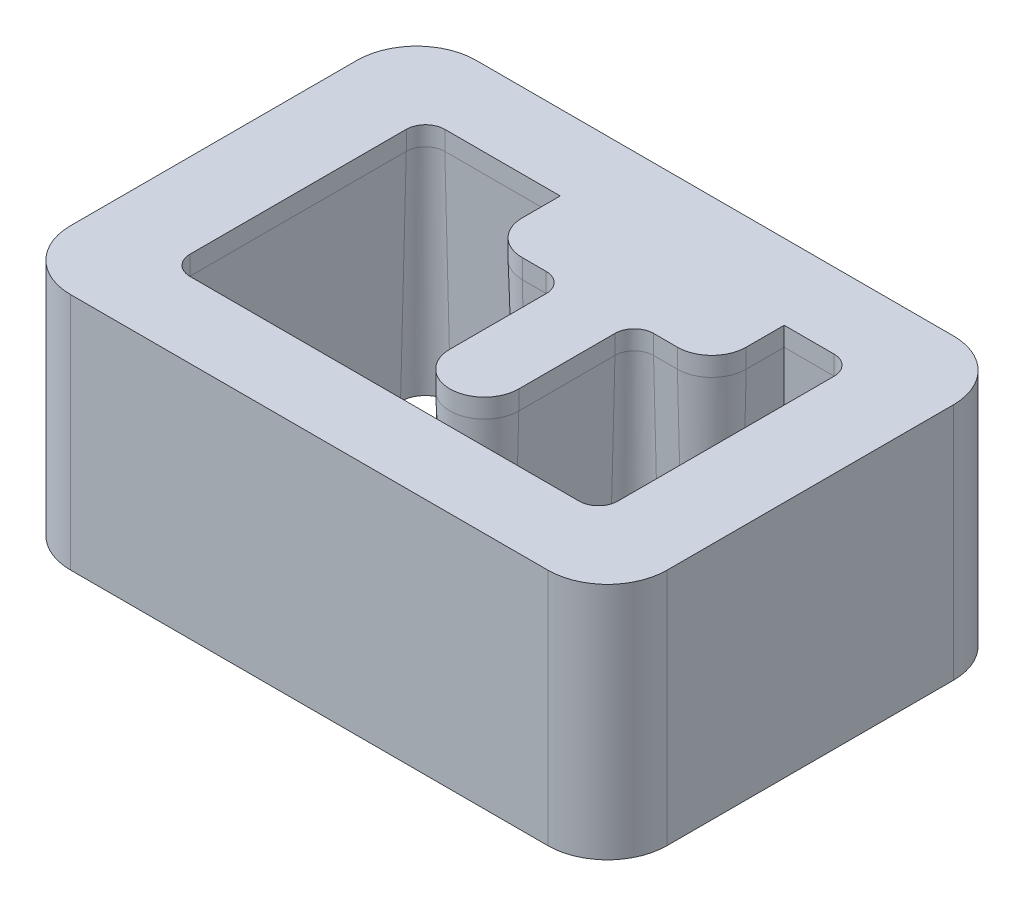
from build123d import *

# Parameters (mm, degrees)
SKETCH1_W                   = 100
SKETCH1_H                   = 68
BOSS_EXTRUDE1_DEPTH         = 40
FILLET1_R                   = 10
CUT_EXTRUDE1_REACH          = 74.498
M6_TAPPED_HOLE1_D           = 5
M6_TAPPED_HOLE1_DEPTH       = 17
M6_TAPPED_HOLE1_CSINK_D     = 6.05
M6_TAPPED_HOLE1_CSINK_ANGLE = 90
M6_TAPPED_HOLE1_TIP         = 1.502151548


with BuildPart() as part:
    # Sketch1 → Boss-Extrude1 (new body)
    with BuildSketch(Plane(origin=(0, 0, 0), x_dir=(1, 0, 0), z_dir=(0, 1, 0))):
        Rectangle(SKETCH1_W, SKETCH1_H)
    extrude(amount=-BOSS_EXTRUDE1_DEPTH)

    # Fillet1
    fillet1_edges = [part.edges().sort_by_distance(p)[0] for p in [
        (-50, -20, -34),
        (50, -20, -34),
        (50, -20, 34),
        (-50, -20, 34),
    ]]
    fillet(fillet1_edges, radius=FILLET1_R)

    # Sketch2 → Cut-Extrude1 (cut, up to next)
    with BuildSketch(Plane(origin=(0, 0, 0), x_dir=(1, 0, 0), z_dir=(0, 1, 0)), mode=Mode.PRIVATE) as cut_extrude1_sk1:
        with BuildLine():
            Line((-32.625, -21.36), (32.625, -21.36))
            ThreePointArc((32.625, -21.36), (34.908954903, -20.413954903), (35.855, -18.13))
            Line((35.855, -18.13), (35.855, 18.13))
            ThreePointArc((35.855, 18.13), (34.908954903, 20.413954903), (32.625, 21.36))
            Line((32.625, 21.36), (24.265, 21.36))
            Line((24.265, 21.36), (24.265, 15))
            ThreePointArc((24.265, 15), (22.575006127, 10.919993873), (18.495, 9.23))
            Line((18.495, 9.23), (14.495, 9.23))
            ThreePointArc((14.495, 9.23), (12.211045097, 8.283954903), (11.265, 6))
            Line((11.265, 6), (11.265, -10.13))
            ThreePointArc((11.265, -10.13), (5.495, -15.9), (-0.275, -10.13))
            Line((-0.275, -10.13), (-0.275, 6))
            ThreePointArc((-0.275, 6), (-1.221045097, 8.283954903), (-3.505, 9.23))
            Line((-3.505, 9.23), (-7.505, 9.23))
            ThreePointArc((-7.505, 9.23), (-11.585006127, 10.919993873), (-13.275, 15))
            Line((-13.275, 15), (-13.275, 21.36))
            Line((-13.275, 21.36), (-32.625, 21.36))
            ThreePointArc((-32.625, 21.36), (-34.908954903, 20.413954903), (-35.855, 18.13))
            Line((-35.855, 18.13), (-35.855, -18.13))
            ThreePointArc((-35.855, -18.13), (-34.908954903, -20.413954903), (-32.625, -21.36))
        make_face()
    cut_extrude1_tool1 = extrude(cut_extrude1_sk1.sketch, amount=-CUT_EXTRUDE1_REACH, mode=Mode.PRIVATE) & part.part
    add(cut_extrude1_tool1.solids().sort_by_distance((-1.698637, 0, 2.611892))[0], mode=Mode.SUBTRACT)

    # Cut-Sweep1: sweep along a path in Sketch5
    with BuildLine(Plane(origin=(0, 0, 0), x_dir=(1, 0, 0), z_dir=(0, 1, 0))) as cut_sweep1_path:
        Line((-32.625, -21.36), (32.625, -21.36))
        ThreePointArc((32.625, -21.36), (34.908954903, -20.413954903), (35.855, -18.13))
        Line((35.855, -18.13), (35.855, 18.13))
        ThreePointArc((35.855, 18.13), (34.908954903, 20.413954903), (32.625, 21.36))
        Line((32.625, 21.36), (24.265, 21.36))
        Line((24.265, 21.36), (24.265, 15))
        ThreePointArc((24.265, 15), (22.575006127, 10.919993873), (18.495, 9.23))
        Line((18.495, 9.23), (14.495, 9.23))
        ThreePointArc((14.495, 9.23), (12.211045097, 8.283954903), (11.265, 6))
        Line((11.265, 6), (11.265, -10.13))
        ThreePointArc((11.265, -10.13), (5.495, -15.9), (-0.275, -10.13))
        Line((-0.275, -10.13), (-0.275, 6))
        ThreePointArc((-0.275, 6), (-1.221045097, 8.283954903), (-3.505, 9.23))
        Line((-3.505, 9.23), (-7.505, 9.23))
        ThreePointArc((-7.505, 9.23), (-11.585006127, 10.919993873), (-13.275, 15))
        Line((-13.275, 15), (-13.275, 21.36))
        Line((-13.275, 21.36), (-32.625, 21.36))
        ThreePointArc((-32.625, 21.36), (-34.908954903, 20.413954903), (-35.855, 18.13))
        Line((-35.855, 18.13), (-35.855, -18.13))
        ThreePointArc((-35.855, -18.13), (-34.908954903, -20.413954903), (-32.625, -21.36))
    # Sketch3 → Cut-Sweep1 (sweep, cut)
    with BuildSketch(Plane.XY):
        Polygon((35.855, -3.2), (36.818641914, -40), (34.855, -40), (34.855, -3.2), align=None)
    sweep(path=cut_sweep1_path.line, transition=Transition.RIGHT, mode=Mode.SUBTRACT)

    # M6 Tapped Hole1
    with Locations(Plane(origin=(0, -40, 0), x_dir=(-1, 0, 0), z_dir=(0, -1, 0))):
        with Locations((-43, 27), (43, 27), (43, -27), (-43, -27)):
            CounterSinkHole(M6_TAPPED_HOLE1_D / 2, M6_TAPPED_HOLE1_CSINK_D / 2, depth=M6_TAPPED_HOLE1_DEPTH, counter_sink_angle=M6_TAPPED_HOLE1_CSINK_ANGLE)
            with Locations((0, 0, -(M6_TAPPED_HOLE1_DEPTH + M6_TAPPED_HOLE1_TIP / 2))):  # 118° drill point
                Cone(0, M6_TAPPED_HOLE1_D / 2, M6_TAPPED_HOLE1_TIP, mode=Mode.SUBTRACT)


solid = part.part
